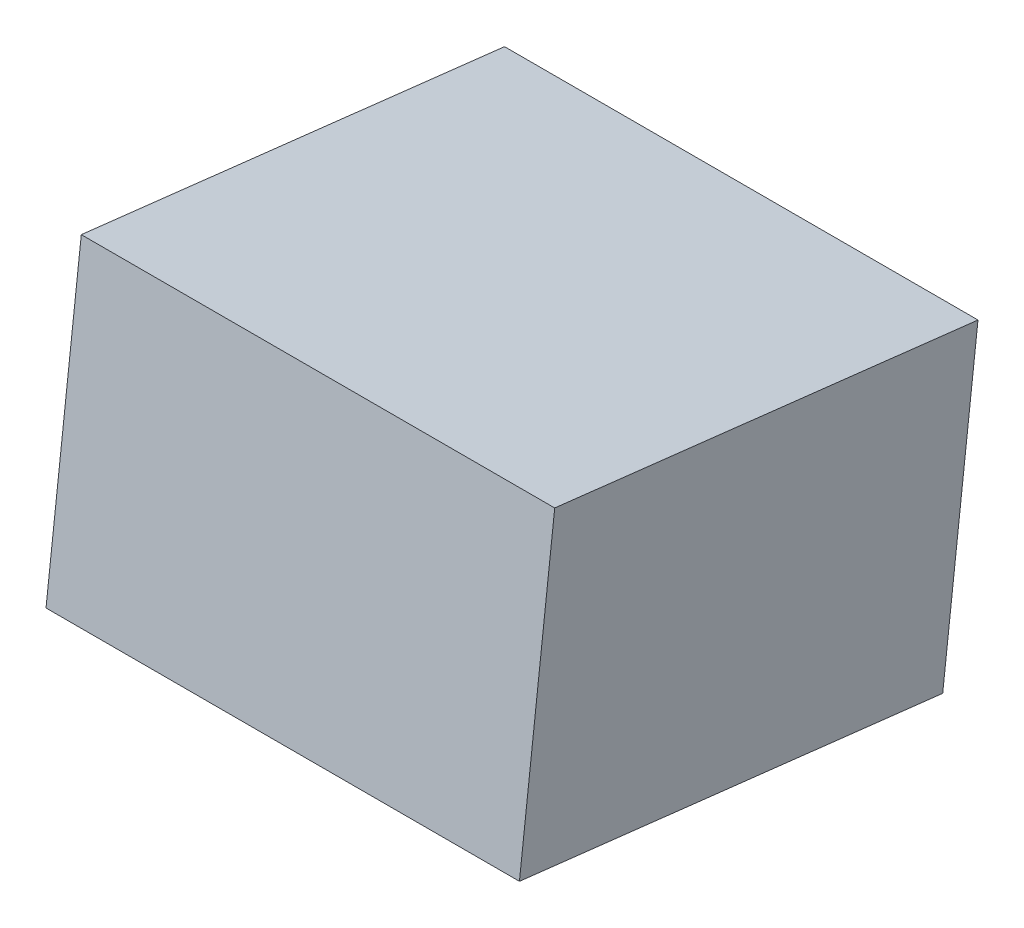
from build123d import *

# Parameters (mm, degrees)
SKETCH1_W           = 200
SKETCH1_H           = 180
BOSS_EXTRUDE1_DEPTH = 130


with BuildPart() as part:
    # Sketch1 → Boss-Extrude1 (new body)
    with BuildSketch(Plane(origin=(0, 358.879876801, -41.422455829), x_dir=(1, 0, 0), z_dir=(-6.837425950214788e-15, 0.9934047622419533, -0.1146602736566085))):
        with Locations((-131.67305734, 211.357042425)):
            Rectangle(SKETCH1_W, SKETCH1_H)
    extrude(amount=BOSS_EXTRUDE1_DEPTH)


solid = part.part
